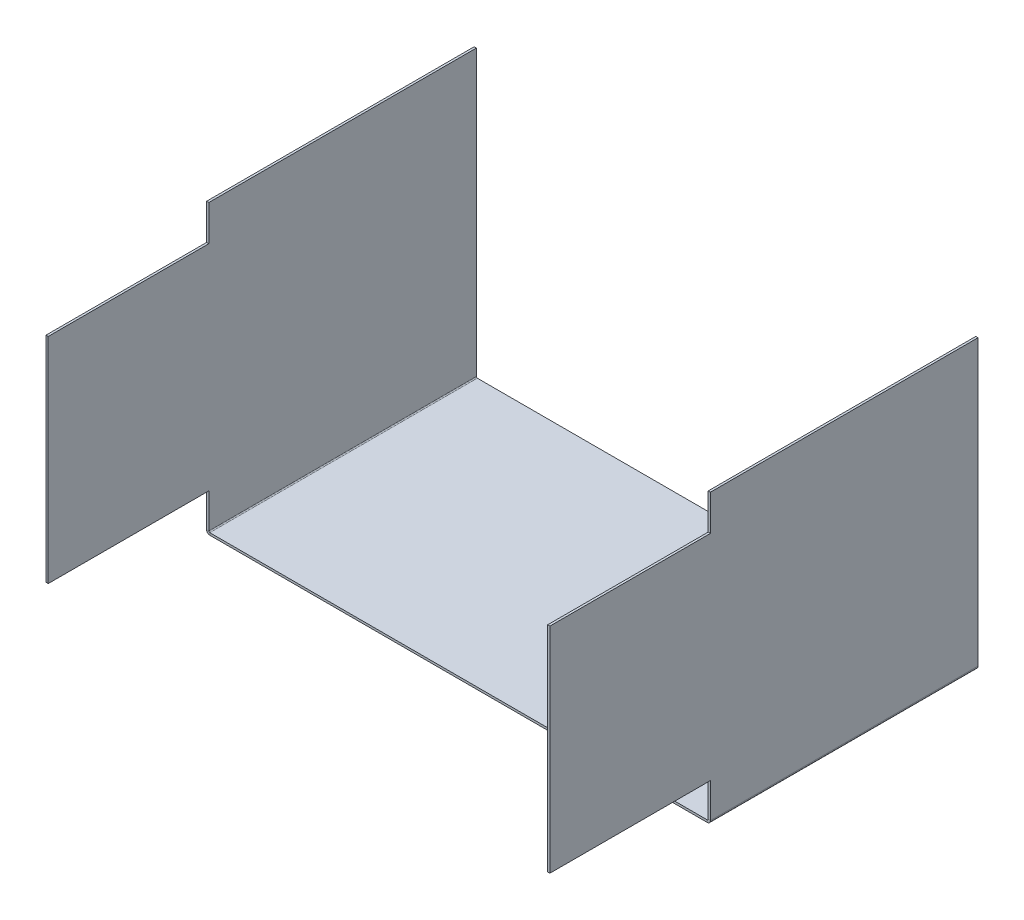
from build123d import *

# Parameters (mm, degrees)
SKETCH1_W                      = 317.5
SKETCH1_H                      = 1.5875
BASE_FLANGE1_DEPTH             = 355.6
EDGE_FLANGE1_STRIP_W           = 7.8232
EDGE_FLANGE1_STRIP_H           = 1.5875
EDGE_FLANGE1_STRIP_CUT_DEPTH   = 317.5
EDGE_FLANGE1_STRIP_2_W         = 7.8232
EDGE_FLANGE1_STRIP_2_H         = 1.5875
EDGE_FLANGE1_STRIP_CUT_2_DEPTH = 317.5
EDGE_FLANGE1_DEPTH             = 317.5
EDGE_FLANGE1_BEND_DEPTH        = 317.5
SKETCH8_W                      = 114.3
SKETCH8_H                      = 152.4
BOSS_EXTRUDE1_DEPTH            = 1.5875
SKETCH10_W                     = 127
SKETCH10_H                     = 254
CUT_EXTRUDE1_DEPTH             = 598.585693253


# Sheet-metal steps are written as plain solids
with BuildPart() as part:
    # Sketch1 → Base-Flange1 (new body)
    with BuildSketch(Plane(origin=(0, 0, 0), x_dir=(0, 0, -1), z_dir=(1, 0, 0))):
        with Locations((-158.75, 0.79375)):
            Rectangle(SKETCH1_W, SKETCH1_H)
    extrude(amount=BASE_FLANGE1_DEPTH)

    # Edge-Flange1 strip (across the edge) → Edge-Flange1 strip cut (cut)
    with BuildSketch(Plane(origin=(355.6, 1.5875, 317.5), x_dir=(-1, 0, 0), z_dir=(0, 0, -1))):
        with Locations((-3.175, -0.79375)):
            Rectangle(EDGE_FLANGE1_STRIP_W, EDGE_FLANGE1_STRIP_H)
    extrude(amount=EDGE_FLANGE1_STRIP_CUT_DEPTH, mode=Mode.SUBTRACT)

    # Edge-Flange1 strip 2 (across the edge) → Edge-Flange1 strip cut 2 (cut)
    with BuildSketch(Plane(origin=(0, 1.5875, 0), x_dir=(1, 0, 0), z_dir=(0, 0, 1))):
        with Locations((-3.175, -0.79375)):
            Rectangle(EDGE_FLANGE1_STRIP_2_W, EDGE_FLANGE1_STRIP_2_H)
    extrude(amount=EDGE_FLANGE1_STRIP_CUT_2_DEPTH, mode=Mode.SUBTRACT)

    # Edge-Flange1 section (across the edge) → Edge-Flange1 (add)
    with BuildSketch(Plane(origin=(355.6, 1.5875, 317.5), x_dir=(-1, 0, 0), z_dir=(0, 0, -1))):
        with BuildLine():
            Line((-1.5875, 0.7366), (-1.5875, 203.2))
            Line((-1.5875, 203.2), (0, 203.2))
            Line((0, 203.2), (0, 0.7366))
            ThreePointArc((0, 0.7366), (0.215745145, 0.215745145), (0.7366, 0))
            Line((0.7366, 0), (0.7366, -1.5875))
            ThreePointArc((0.7366, -1.5875), (-0.90678687, -0.90678687), (-1.5875, 0.7366))
        make_face()
    extrude(amount=EDGE_FLANGE1_DEPTH)

    # Edge-Flange1 section 2 (across the edge) → Edge-Flange1 bend (add)
    with BuildSketch(Plane(origin=(0, 1.5875, 0), x_dir=(1, 0, 0), z_dir=(0, 0, 1))):
        with BuildLine():
            Line((-1.5875, 0.7366), (-1.5875, 203.2))
            Line((-1.5875, 203.2), (0, 203.2))
            Line((0, 203.2), (0, 0.7366))
            ThreePointArc((0, 0.7366), (0.215745145, 0.215745145), (0.7366, 0))
            Line((0.7366, 0), (0.7366, -1.5875))
            ThreePointArc((0.7366, -1.5875), (-0.90678687, -0.90678687), (-1.5875, 0.7366))
        make_face()
    extrude(amount=EDGE_FLANGE1_BEND_DEPTH)


with BuildPart() as body_2:
    # Sketch8 → Boss-Extrude1 (new body)
    with BuildSketch(Plane(origin=(357.1875, 0, 0), x_dir=(0, 0, -1), z_dir=(1, 0, 0))):
        with Locations((-374.65, 103.1875)):
            Rectangle(SKETCH8_W, SKETCH8_H)
    extrude(amount=-BOSS_EXTRUDE1_DEPTH)


with BuildPart() as body_3:
    # Mirror1: mirrored copy
    add(body_2.part.mirror(Plane(origin=(177.8, 0, 0), x_dir=(0, 0, 1), z_dir=(1, 0, 0))))


with BuildPart() as body_2_1:
    add(body_2.part)

    # Combine1: union part, body 3
    add(part.part)
    add(body_3.part)

    # Sketch10 → Cut-Extrude1 (cut, through all)
    with BuildSketch(Plane(origin=(357.1875, 0, 0), x_dir=(0, 0, -1), z_dir=(1, 0, 0))):
        with Locations((-63.5, 77.7875)):
            Rectangle(SKETCH10_W, SKETCH10_H)
    extrude(amount=-CUT_EXTRUDE1_DEPTH, mode=Mode.SUBTRACT)


solid = body_2_1.part
